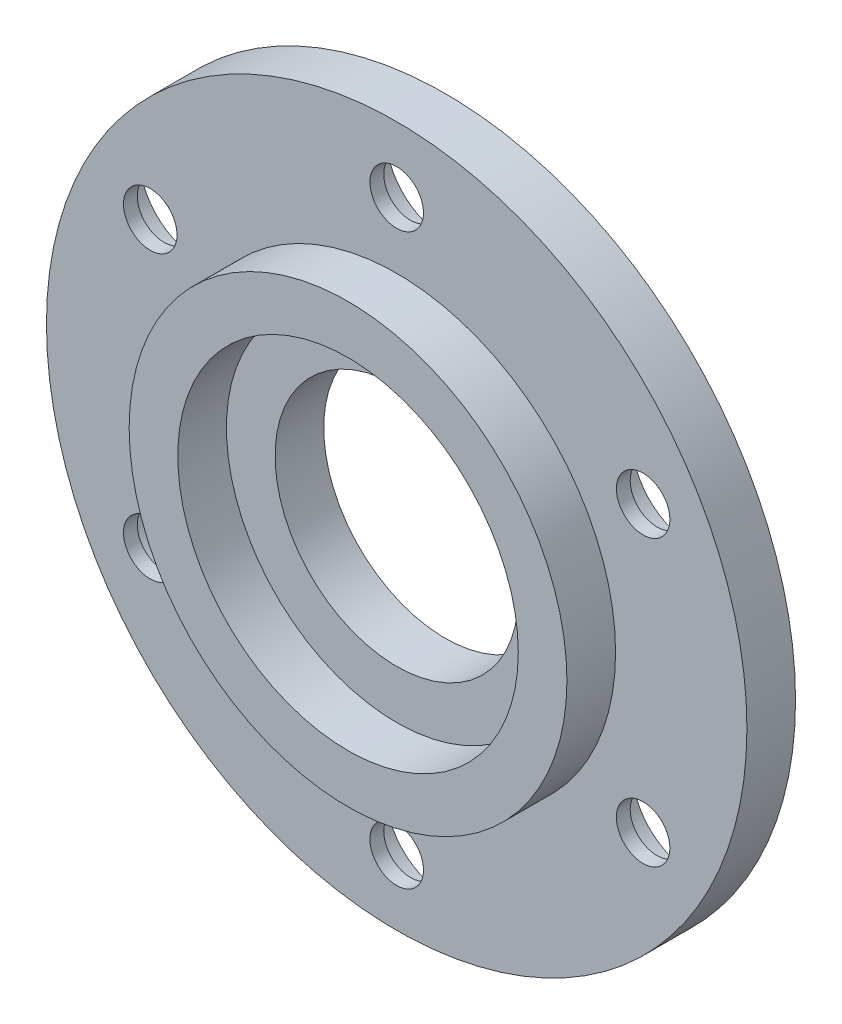
from build123d import *

# Parameters (mm, degrees)
SKETCH_CENTER_CUT_R                     = 12.5
CUT_CENTER_DEPTH                        = 52.15662225
CBORE_FOR_M5_HEX_HEAD_BOLT1_D           = 5.5
CBORE_FOR_M5_HEX_HEAD_BOLT1_CBORE_D     = 12.24
CBORE_FOR_M5_HEX_HEAD_BOLT1_CBORE_DEPTH = 3.58
CIRPATTERN1_COUNT                       = 6


with BuildPart() as part:
    # Sketch Spindle Skeleton → Main Revolve (revolve)
    with BuildSketch(Plane(origin=(0, 0, 0), x_dir=(0, 0, -1), z_dir=(1, 0, 0))):
        Polygon((-24.2, 17.5), (-24.2, 9.5), (-19.2, 9.5), (-19.2, 36), (-24.2, 36), (-24.2, 22.5), (-29.2, 22.5), (-29.2, 17.5), align=None)
    revolve(axis=Axis((0, 0, 1000), (0, 0, -1)))

    # Sketch Center Cut → Cut Center (cut, through all)
    with BuildSketch(Plane.XY.offset(24.2)):
        Circle(SKETCH_CENTER_CUT_R)
    extrude(amount=-CUT_CENTER_DEPTH, mode=Mode.SUBTRACT)

    # CBORE for M5 Hex Head Bolt1 (through all)
    with Locations(Plane(origin=(0, 0, 19.2), x_dir=(-1, 0, 0), z_dir=(0, 0, -1))):
        with Locations((0, 29.25)):
            cbore_for_m5_hex_head_bolt1 = CounterBoreHole(CBORE_FOR_M5_HEX_HEAD_BOLT1_D / 2, CBORE_FOR_M5_HEX_HEAD_BOLT1_CBORE_D / 2, CBORE_FOR_M5_HEX_HEAD_BOLT1_CBORE_DEPTH)

    # CirPattern1: CBORE for M5 Hex Head Bolt1 ×6 about axis
    cirpattern1_axis = Axis((0, 0, 19.2), (0, 0, 1))
    for i in range(1, CIRPATTERN1_COUNT):
        add(cbore_for_m5_hex_head_bolt1.rotate(cirpattern1_axis, i * 360 / CIRPATTERN1_COUNT), mode=Mode.SUBTRACT)


solid = part.part
